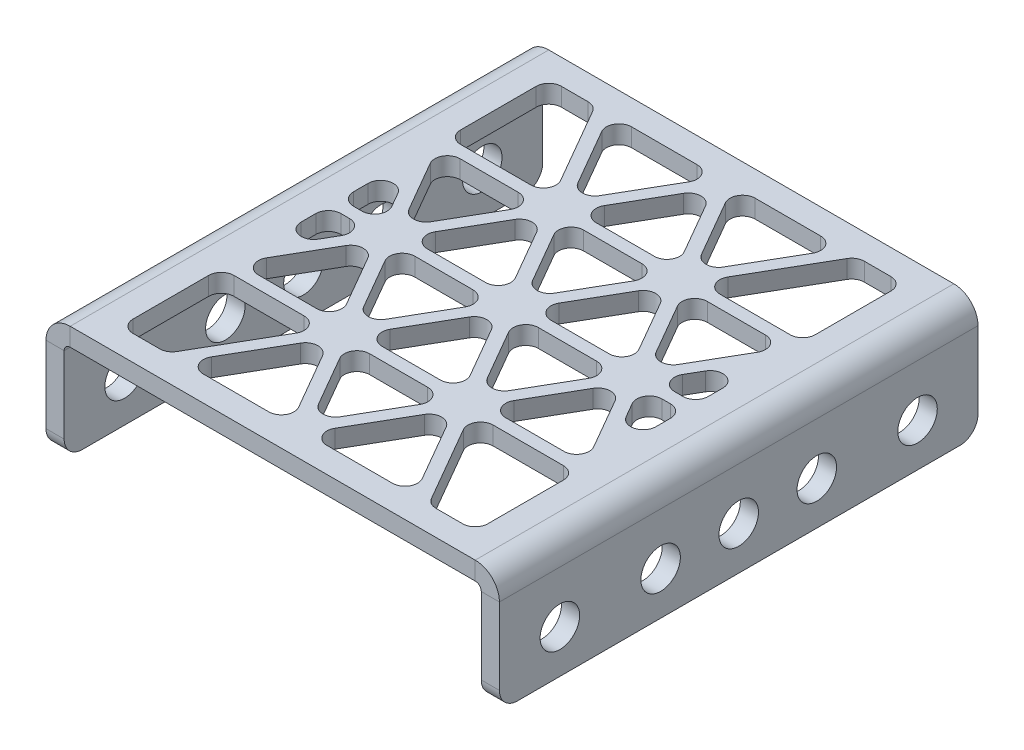
from build123d import *

# Parameters (mm, degrees)
BASE_FLANGE1_DEPTH      = 60.325
CUT_EXTRUDE1_DEPTH      = 68.306884834
CUT_EXTRUDE1_DEPTH_BACK = 68.306884834
SKETCH6_R               = 2.4892
CUT_EXTRUDE2_DEPTH      = 2.54
FILLET1_R               = 1.5875
FILLET2_R               = 2.286


# Sheet-metal steps are written as plain solids
with BuildPart() as part:
    # Sketch1 → Base-Flange1 (new body)
    with BuildSketch(Plane.XY):
        with BuildLine():
            Line((-26.289, -6.35), (-26.289, 5.588))
            ThreePointArc((-26.289, 5.588), (-26.065815367, 6.126815367), (-25.527, 6.35))
            Line((-25.527, 6.35), (25.527, 6.35))
            ThreePointArc((25.527, 6.35), (26.065815367, 6.126815367), (26.289, 5.588))
            Line((26.289, 5.588), (26.289, -6.35))
            Line((26.289, -6.35), (28.575, -6.35))
            Line((28.575, -6.35), (28.575, 5.588))
            ThreePointArc((28.575, 5.588), (27.682261469, 7.743261469), (25.527, 8.636))
            Line((25.527, 8.636), (-25.527, 8.636))
            ThreePointArc((-25.527, 8.636), (-27.682261469, 7.743261469), (-28.575, 5.588))
            Line((-28.575, 5.588), (-28.575, -6.35))
            Line((-28.575, -6.35), (-26.289, -6.35))
        make_face()
    extrude(amount=BASE_FLANGE1_DEPTH)

    # Sketch6 → Cut-Extrude1 (cut, two sides: drawn at the far end of the back side and taken through both)
    with BuildSketch(Plane(origin=(0, 0, 0), x_dir=(0, 0, -1), z_dir=(1, 0, 0)).offset(-CUT_EXTRUDE1_DEPTH_BACK)):
        with Locations((-30.1625, -0.92202)):
            Circle(SKETCH6_R)
        with Locations((-20.32, -0.92202)):
            Circle(SKETCH6_R)
        with Locations((-7.62, -0.92202)):
            Circle(SKETCH6_R)
        with Locations(Location((-52.705, -0.92202, 0), (0, 0, 180))):
            Circle(SKETCH6_R)
        with Locations(Location((-40.005, -0.92202, 0), (0, 0, 180))):
            Circle(SKETCH6_R)
    extrude(amount=CUT_EXTRUDE1_DEPTH + CUT_EXTRUDE1_DEPTH_BACK, mode=Mode.SUBTRACT)

    # Sketch7 → Cut-Extrude2 (cut)
    with BuildSketch(Plane(origin=(0, 8.636, 0), x_dir=(1, 0, 0), z_dir=(0, 1, 0))):
        Polygon((-22.352, -15.875), (-9.165435523, -15.875), (-16.497783942, -3.175), (-22.352, -3.175), align=None)
        Polygon((-14.664696837, -3.175), (-7.790620195, -15.08125), (-0.916543552, -3.175), align=None)
        Polygon((-6.415804866, -15.875), (6.415804866, -15.875), (0, -4.7625), align=None)
        Polygon((0.916543552, -3.175), (7.790620195, -15.08125), (14.664696837, -3.175), align=None)
        Polygon((9.165435523, -15.875), (22.352, -15.875), (22.352, -3.175), (16.497783942, -3.175), align=None)
        Polygon((1.374815329, -29.36875), (14.206425061, -29.36875), (7.790620195, -18.25625), align=None)
        Polygon((0, -28.575), (6.415804866, -17.4625), (-6.415804866, -17.4625), align=None)
        Polygon((-14.206425061, -29.36875), (-1.374815329, -29.36875), (-7.790620195, -18.25625), align=None)
        Polygon((-22.352, -29.36875), (-16.956055718, -29.36875), (-22.352, -20.022700349), align=None)
        Polygon((-22.352, -40.302299651), (-16.956055718, -30.95625), (-22.352, -30.95625), align=None)
        Polygon((-9.165435523, -42.8625), (-15.58124039, -31.75), (-21.997045256, -42.8625), align=None)
        Polygon((-7.790620195, -42.06875), (-1.374815329, -30.95625), (-14.206425061, -30.95625), align=None)
        Polygon((6.415804866, -42.8625), (0, -31.75), (-6.415804866, -42.8625), align=None)
        Polygon((7.790620195, -42.06875), (14.206425061, -30.95625), (1.374815329, -30.95625), align=None)
        Polygon((21.997045256, -42.8625), (15.58124039, -31.75), (9.165435523, -42.8625), align=None)
        Polygon((22.352, -30.95625), (16.956055718, -30.95625), (22.352, -40.302299651), align=None)
        Polygon((22.352, -20.022700349), (16.956055718, -29.36875), (22.352, -29.36875), align=None)
        Polygon((22.352, -44.45), (9.165435523, -44.45), (16.497783942, -57.15), (22.352, -57.15), align=None)
        Polygon((14.664696837, -57.15), (7.790620195, -45.24375), (0.916543552, -57.15), align=None)
        Polygon((0, -55.5625), (6.415804866, -44.45), (-6.415804866, -44.45), align=None)
        Polygon((-0.916543552, -57.15), (-7.790620195, -45.24375), (-14.664696837, -57.15), align=None)
        Polygon((-16.497783942, -57.15), (-9.165435523, -44.45), (-22.352, -44.45), (-22.352, -57.15), align=None)
        Polygon((-15.58124039, -28.575), (-9.165435523, -17.4625), (-21.997045256, -17.4625), (-21.664592336, -18.038325349), align=None)
        Polygon((15.58124039, -28.575), (21.664592336, -18.038325349), (21.997045256, -17.4625), (9.165435523, -17.4625), align=None)
    extrude(amount=-CUT_EXTRUDE2_DEPTH, mode=Mode.SUBTRACT)

    # Fillet1
    fillet1_edges = [part.edges().sort_by_distance(p)[0] for p in [
        (-7.790620195, 7.493, 42.06875),
        (-14.206425061, 7.493, 30.95625),
        (-1.374815329, 7.493, 30.95625),
        (-6.415804866, 7.493, 42.8625),
        (0, 7.493, 31.75),
        (6.415804866, 7.493, 42.8625),
        (-22.352, 7.493, 40.302299651),
        (-22.352, 7.493, 30.95625),
        (-16.956055718, 7.493, 30.95625),
        (-21.997045256, 7.493, 42.8625),
        (-15.58124039, 7.493, 31.75),
        (-9.165435523, 7.493, 42.8625),
        (16.956055718, 7.493, 29.36875),
        (22.352, 7.493, 20.022700349),
        (22.352, 7.493, 29.36875),
        (16.956055718, 7.493, 30.95625),
        (22.352, 7.493, 30.95625),
        (22.352, 7.493, 40.302299651),
        (7.790620195, 7.493, 42.06875),
        (1.374815329, 7.493, 30.95625),
        (14.206425061, 7.493, 30.95625),
        (9.165435523, 7.493, 42.8625),
        (15.58124039, 7.493, 31.75),
        (21.997045256, 7.493, 42.8625),
        (0, 7.493, 28.575),
        (-6.415804866, 7.493, 17.4625),
        (6.415804866, 7.493, 17.4625),
        (1.374815329, 7.493, 29.36875),
        (7.790620195, 7.493, 18.25625),
        (14.206425061, 7.493, 29.36875),
        (-14.206425061, 7.493, 29.36875),
        (-7.790620195, 7.493, 18.25625),
        (-1.374815329, 7.493, 29.36875),
        (-22.352, 7.493, 29.36875),
        (-22.352, 7.493, 20.022700349),
        (-16.956055718, 7.493, 29.36875),
        (-6.415804866, 7.493, 15.875),
        (0, 7.493, 4.7625),
        (6.415804866, 7.493, 15.875),
        (-7.790620195, 7.493, 15.08125),
        (-14.664696837, 7.493, 3.175),
        (-0.916543552, 7.493, 3.175),
        (9.165435523, 7.493, 15.875),
        (16.497783942, 7.493, 3.175),
        (22.352, 7.493, 3.175),
        (22.352, 7.493, 15.875),
        (7.790620195, 7.493, 15.08125),
        (0.916543552, 7.493, 3.175),
        (14.664696837, 7.493, 3.175),
        (15.58124039, 7.493, 28.575),
        (9.165435523, 7.493, 17.4625),
        (21.997045256, 7.493, 17.4625),
        (-15.58124039, 7.493, 28.575),
        (-21.997045256, 7.493, 17.4625),
        (-9.165435523, 7.493, 17.4625),
        (-16.497783942, 7.493, 57.15),
        (-22.352, 7.493, 57.15),
        (-22.352, 7.493, 44.45),
        (-9.165435523, 7.493, 44.45),
        (14.664696837, 7.493, 57.15),
        (0.916543552, 7.493, 57.15),
        (7.790620195, 7.493, 45.24375),
        (9.165435523, 7.493, 44.45),
        (22.352, 7.493, 44.45),
        (22.352, 7.493, 57.15),
        (16.497783942, 7.493, 57.15),
        (-0.916543552, 7.493, 57.15),
        (-14.664696837, 7.493, 57.15),
        (-7.790620195, 7.493, 45.24375),
        (0, 7.493, 55.5625),
        (-6.415804866, 7.493, 44.45),
        (6.415804866, 7.493, 44.45),
        (-9.165435523, 7.493, 15.875),
        (-22.352, 7.493, 15.875),
        (-22.352, 7.493, 3.175),
        (-16.497783942, 7.493, 3.175),
    ]]
    fillet(fillet1_edges, radius=FILLET1_R)

    # Fillet2
    fillet2_edges = [part.edges().sort_by_distance(p)[0] for p in [
        (27.432, -6.35, 0),
        (-27.432, -6.35, 0),
        (27.432, -6.35, 60.325),
        (-27.432, -6.35, 60.325),
    ]]
    fillet(fillet2_edges, radius=FILLET2_R)


solid = part.part
